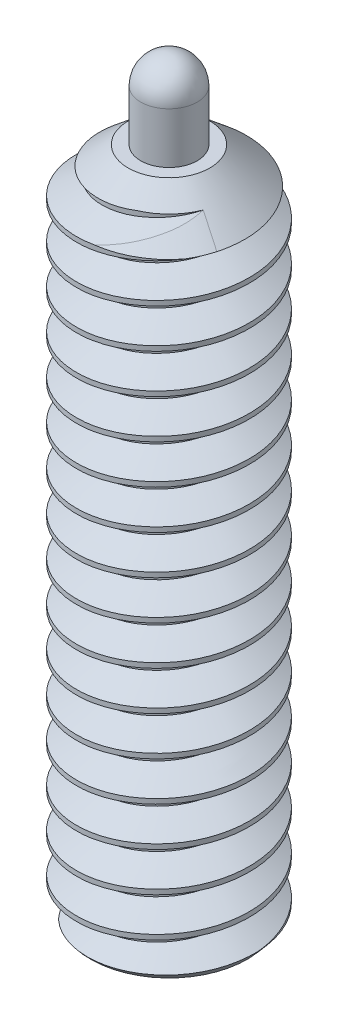
from build123d import *

# Parameters (mm, degrees)
SKETCH24_W       = 1.7526
SKETCH24_H       = 13.4874
CUT_SWEEP1_PITCH = 0.79375
SKETCH26_W       = 0.5715
SKETCH26_H       = 12.2174
EXTRUDE12_DEPTH  = 0.635


with BuildPart() as part:
    # Sketch24 → Revolve1 (revolve)
    with BuildSketch(Plane(origin=(0, 0, 0), x_dir=(0, 0, -1), z_dir=(1, 0, 0)), mode=Mode.PRIVATE) as revolve1_sk:
        with Locations((0.8763, 0)):
            Rectangle(SKETCH24_W, SKETCH24_H)
    revolve(revolve1_sk.sketch.rotate(Axis((0, 6.7437, 0), (0, -1, 0)), 180), axis=Axis((0, 6.7437, 0), (0, -1, 0)))

    # Cut-Sweep1: the profile of Sketch38 profile screwed along a right-hand helix of 17.992 turns, 8 arcs to a turn; built about Z, then put on its axis
    cut_sweep1_z = Axis((0, 0, 0), (0, 0, 1))
    cut_sweep1_corners = [(1.7529, 0, -0.694704455), (1.7529, 0, 0.000173205), (1.237044252, 0, -0.29765625), (1.237044252, 0, -0.396875)]
    with BuildLine(mode=Mode.PRIVATE) as cut_sweep1_profile:
        Line(cut_sweep1_corners[0], cut_sweep1_corners[1])
        Line(cut_sweep1_corners[1], cut_sweep1_corners[2])
        Line(cut_sweep1_corners[2], cut_sweep1_corners[3])
        Line(cut_sweep1_corners[3], cut_sweep1_corners[0])
    cut_sweep1_cap = Face(cut_sweep1_profile.wire())
    cut_sweep1_turn_angles = [0, 22.5, 45, 67.5, 90, 112.5, 135, 157.5, 180, 202.5, 225, 247.5, 270, 292.5, 315, 337.5, 360]
    cut_sweep1_turn_weights = [1, 0.9238795325112867, 1, 0.9238795325112867, 1, 0.9238795325112867, 1, 0.9238795325112867, 1, 0.9238795325112867, 1, 0.9238795325112867, 1, 0.9238795325112867, 1, 0.9238795325112867, 1]
    cut_sweep1_turn_rails = [Edge.make_bspline([Vector(p[0], p[1], 0).rotate(cut_sweep1_z, cut_sweep1_turn_angles[k]) / cut_sweep1_turn_weights[k] + Vector(0, 0, p[2] + CUT_SWEEP1_PITCH * cut_sweep1_turn_angles[k] / 360) for k in range(17)], [0, 0, 0, 1, 1, 2, 2, 3, 3, 4, 4, 5, 5, 6, 6, 7, 7, 8, 8, 8], 2, cut_sweep1_turn_weights) for p in cut_sweep1_corners]
    cut_sweep1_turn_sides = [Face.make_surface_from_curves(cut_sweep1_turn_rails[p[0]], cut_sweep1_turn_rails[p[1]]) for p in [(0, 1), (1, 2), (2, 3), (3, 0)]]
    cut_sweep1_last_angles = [6120, 6142.5, 6165, 6187.5, 6210, 6232.5, 6255, 6277.5, 6300, 6322.5, 6345, 6367.5, 6390, 6412.5, 6435, 6456.06, 6477.12]
    cut_sweep1_last_weights = [1, 0.9238795325112867, 1, 0.9238795325112867, 1, 0.9238795325112867, 1, 0.9238795325112867, 1, 0.9238795325112867, 1, 0.9238795325112867, 1, 0.9238795325112867, 1, 0.933204632633859, 1]
    cut_sweep1_last_rails = [Edge.make_bspline([Vector(p[0], p[1], 0).rotate(cut_sweep1_z, cut_sweep1_last_angles[k]) / cut_sweep1_last_weights[k] + Vector(0, 0, p[2] + CUT_SWEEP1_PITCH * cut_sweep1_last_angles[k] / 360) for k in range(17)], [0, 0, 0, 1, 1, 2, 2, 3, 3, 4, 4, 5, 5, 6, 6, 7, 7, 8, 8, 8], 2, cut_sweep1_last_weights) for p in cut_sweep1_corners]
    cut_sweep1_last_sides = [Face.make_surface_from_curves(cut_sweep1_last_rails[p[0]], cut_sweep1_last_rails[p[1]]) for p in [(0, 1), (1, 2), (2, 3), (3, 0)]]
    cut_sweep1 = Plane(origin=(0, 6.7437, 0), x_dir=(0, 0, 1), z_dir=(0, -1, 0)) * Solid(Shell([*[p.moved(Location((0, 0, CUT_SWEEP1_PITCH * i))) for i in range(17) for p in cut_sweep1_turn_sides], *cut_sweep1_last_sides, cut_sweep1_cap, cut_sweep1_cap.rotate(cut_sweep1_z, 6477.12).moved(Location((0, 0, CUT_SWEEP1_PITCH * 6477.12 / 360)))]))
    add(cut_sweep1, mode=Mode.SUBTRACT)

    # Sketch26 → Cut-Revolve10 (revolve, cut)
    with BuildSketch(Plane(origin=(0, 0, 0), x_dir=(0, 0, -1), z_dir=(1, 0, 0))):
        with Locations((0.28575, 0.635)):
            Rectangle(SKETCH26_W, SKETCH26_H)
    revolve(axis=Axis((0, -5.4737, 0), (0, 1, 0)), mode=Mode.SUBTRACT)

    # Sketch31 → Cut-Revolve13 (revolve, cut)
    with BuildSketch(Plane(origin=(0, 0, 0), x_dir=(0, 0, -1), z_dir=(1, 0, 0)), mode=Mode.PRIVATE) as cut_revolve13_sk:
        Polygon((1.7526, -6.7437), (1.5875, -6.7437), (1.7526, -6.546941482), align=None)
        Polygon((1.7526, 6.7437), (0.8255, 6.7437), (1.7526, 5.965770732), align=None)
    revolve(cut_revolve13_sk.sketch.rotate(Axis((0, 6.7437, 0), (0, -1, 0)), 111.642979043), axis=Axis((0, 6.7437, 0), (0, -1, 0)), mode=Mode.SUBTRACT)

    # Sketch46 → Extrude12 (cut)
    with BuildSketch(Plane.XZ.offset(6.7437)):
        Polygon((-0.635, 0.366617421), (-0.635, -0.366617421), (0, -0.733234842), (0.635, -0.366617421), (0.635, 0.366617421), (0, 0.733234842), align=None)
    extrude(amount=-EXTRUDE12_DEPTH, mode=Mode.SUBTRACT)

    # Extrude13 cone 1 section (through the dimple's axis) → Extrude13 (revolve, cut)
    with BuildSketch(Plane(origin=(0, -6.7437, 0), x_dir=(0, 0, -1), z_dir=(1, 0, 0))):
        Polygon((0, 0), (0.733234842, 0), (0, 0.423333333), align=None)
    revolve(axis=Axis((0, -6.7437, 0), (0, 1, 0)), mode=Mode.SUBTRACT)


with BuildPart() as body_2:
    # Sketch27 → Revolve2 (revolve)
    with BuildSketch(Plane(origin=(0, 0, 0), x_dir=(0, 0, -1), z_dir=(1, 0, 0)), mode=Mode.PRIVATE) as revolve2_sk:
        with BuildLine():
            Line((0, 8.3439), (0, 0.635))
            Line((0, 0.635), (0.5715, 0.635))
            Line((0.5715, 0.635), (0.5715, 7.7724))
            ThreePointArc((0.5715, 7.7724), (0.404111525, 8.176511525), (0, 8.3439))
        make_face()
    revolve(revolve2_sk.sketch.rotate(Axis((0, 8.3439, 0), (0, -1, 0)), 111.642979043), axis=Axis((0, 8.3439, 0), (0, -1, 0)))


solid = Compound([part.part, body_2.part])
